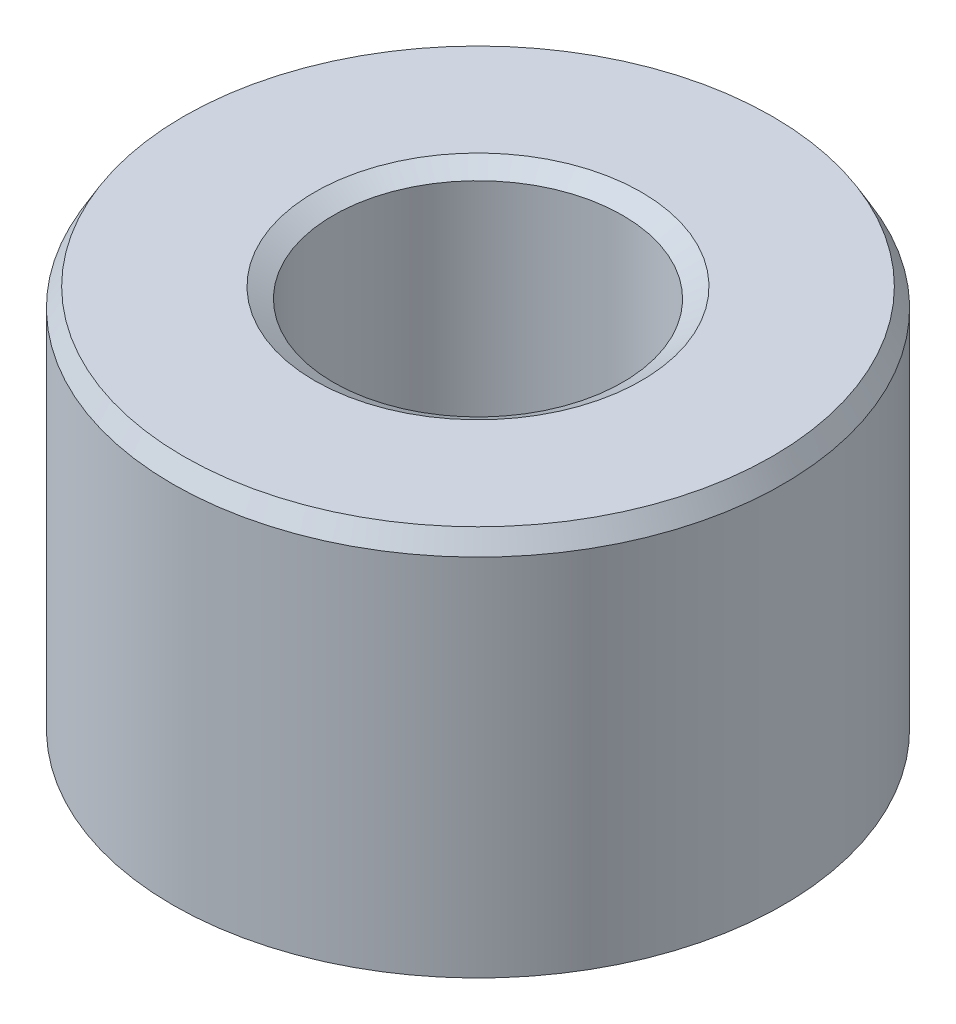
from build123d import *
from OCP.BRepFilletAPI import BRepFilletAPI_MakeChamfer

# Parameters (mm, degrees)
SKETCH1_R           = 45
BOSS_EXTRUDE1_DEPTH = 58.0837586
SKETCH2_R           = 21.334692307
CUT_EXTRUDE1_DEPTH  = 87.16102955
CHAMFER1_SIZE       = 2.752646681
CHAMFER1_SIZE2      = 1.589241302


with BuildPart() as part:
    # Sketch1 → Boss-Extrude1 (new body)
    with BuildSketch(Plane(origin=(0, 0, 0), x_dir=(1, 0, 0), z_dir=(0, 1, 0))):
        Circle(SKETCH1_R)
    extrude(amount=BOSS_EXTRUDE1_DEPTH)

    # Sketch2 → Cut-Extrude1 (cut, through all)
    with BuildSketch(Plane(origin=(0, 0, 0), x_dir=(1, 0, 0), z_dir=(0, 1, 0))):
        Circle(SKETCH2_R)
    extrude(amount=CUT_EXTRUDE1_DEPTH, mode=Mode.SUBTRACT)

    # Chamfer1: one chamfer whose edges measure the first distance from different faces: ONE call of the kernel's chamfer builder (chamfer() names one face for all edges)
    chamfer1_edges_1 = [part.edges().sort_by_distance(p)[0] for p in [
        (-21.334692307, 58.0837586, 0),
    ]]
    chamfer1_side_1 = [part.faces().sort_by_distance(p)[0] for p in [
        (-43.727207794, 58.0837586, 0),
    ]]
    chamfer1_edges_2 = [part.edges().sort_by_distance(p)[0] for p in [
        (-21.334692307, 0, 0),
    ]]
    chamfer1_side_2 = [part.faces().sort_by_distance(p)[0] for p in [
        (-21.334692307, 29.0418793, 0),
    ]]
    chamfer1_edges_3 = [part.edges().sort_by_distance(p)[0] for p in [
        (-45, 0, 0),
    ]]
    chamfer1_side_3 = [part.faces().sort_by_distance(p)[0] for p in [
        (-43.727207794, 0, 0),
    ]]
    chamfer1_edges_4 = [part.edges().sort_by_distance(p)[0] for p in [
        (-45, 58.0837586, 0),
    ]]
    chamfer1_side_4 = [part.faces().sort_by_distance(p)[0] for p in [
        (-45, 29.0418793, 0),
    ]]
    chamfer1 = BRepFilletAPI_MakeChamfer(part.part.solid().wrapped)
    for e in chamfer1_edges_1:
        chamfer1.Add(CHAMFER1_SIZE, CHAMFER1_SIZE2, e.wrapped, chamfer1_side_1[0].wrapped)  # the first distance lies on this face
    for e in chamfer1_edges_2:
        chamfer1.Add(CHAMFER1_SIZE, CHAMFER1_SIZE2, e.wrapped, chamfer1_side_2[0].wrapped)  # the first distance lies on this face
    for e in chamfer1_edges_3:
        chamfer1.Add(CHAMFER1_SIZE, CHAMFER1_SIZE2, e.wrapped, chamfer1_side_3[0].wrapped)  # the first distance lies on this face
    for e in chamfer1_edges_4:
        chamfer1.Add(CHAMFER1_SIZE, CHAMFER1_SIZE2, e.wrapped, chamfer1_side_4[0].wrapped)  # the first distance lies on this face
    add(Compound.cast(chamfer1.Shape()), mode=Mode.REPLACE)


solid = part.part
